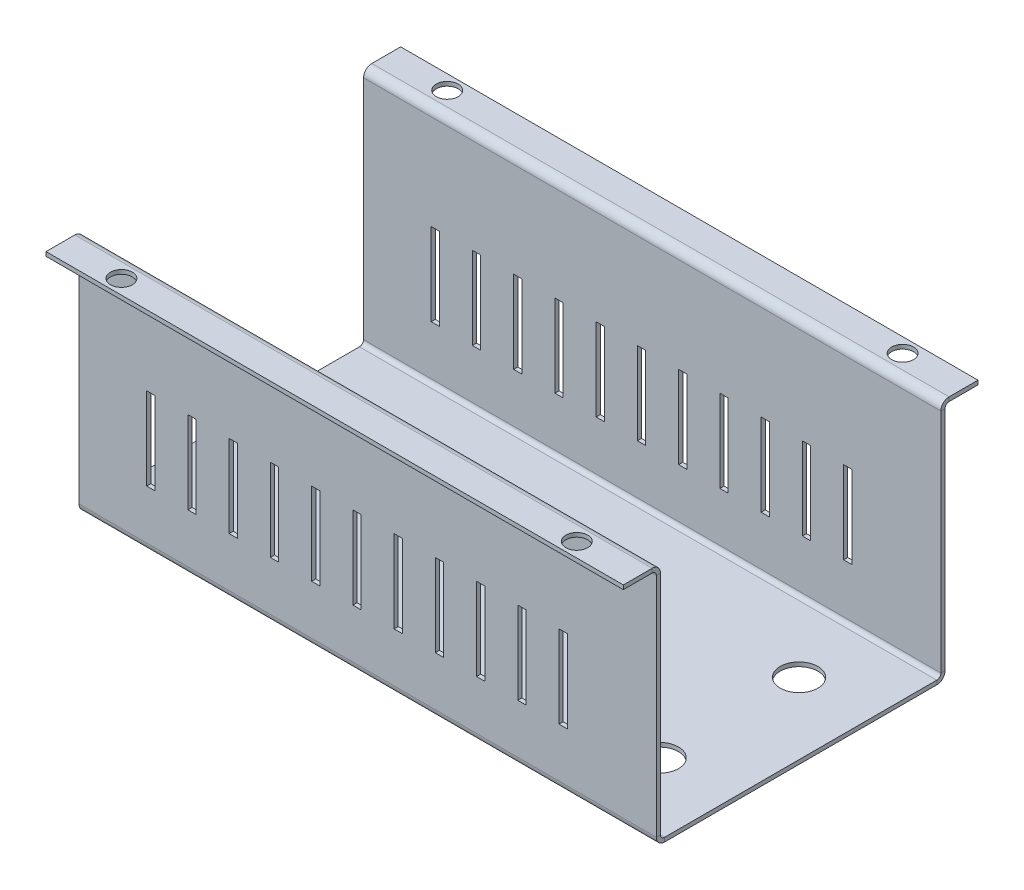
from build123d import *

# Parameters (mm, degrees)
SKETCH1_W                      = 140
SKETCH1_H                      = 70
BASE_FLANGE1_DEPTH             = 1
EDGE_FLANGE1_STRIP_W           = 6
EDGE_FLANGE1_STRIP_H           = 1
EDGE_FLANGE1_STRIP_CUT_DEPTH   = 140
EDGE_FLANGE1_STRIP_2_W         = 6
EDGE_FLANGE1_STRIP_2_H         = 1
EDGE_FLANGE1_STRIP_CUT_2_DEPTH = 140
EDGE_FLANGE1_DEPTH             = 140
EDGE_FLANGE1_BEND_DEPTH        = 140
EDGE_FLANGE2_STRIP_W           = 6
EDGE_FLANGE2_STRIP_H           = 1
EDGE_FLANGE2_STRIP_CUT_DEPTH   = 140
EDGE_FLANGE2_DEPTH             = 140
EDGE_FLANGE3_STRIP_W           = 6
EDGE_FLANGE3_STRIP_H           = 1
EDGE_FLANGE3_STRIP_CUT_DEPTH   = 140
EDGE_FLANGE3_DEPTH             = 140
CUT_EXTRUDE1_DEPTH             = 120.783137378
CUT_EXTRUDE1_DEPTH_BACK        = 120.783137378
SKETCH18_W                     = 2
SKETCH18_H                     = 20
CUT_EXTRUDE2_DEPTH             = 101.56341283
CUT_EXTRUDE2_DEPTH_BACK        = 101.56341283
SKETCH20_R                     = 2.651793261
CUT_EXTRUDE3_DEPTH             = 102.143462468
CUT_EXTRUDE3_DEPTH_BACK        = 102.143462468
SKETCH21_R                     = 4.568960442


# Sheet-metal steps are written as plain solids
with BuildPart() as part:
    # Sketch1 → Base-Flange1 (new body)
    with BuildSketch(Plane(origin=(0, 0, 0), x_dir=(1, 0, 0), z_dir=(0, 1, 0))):
        Rectangle(SKETCH1_W, SKETCH1_H)
    extrude(amount=-BASE_FLANGE1_DEPTH)

    # Edge-Flange1 strip (across the edge) → Edge-Flange1 strip cut (cut)
    with BuildSketch(Plane(origin=(-70, 0, 35), x_dir=(0, 0, -1), z_dir=(1, 0, 0))):
        with Locations((-1, -0.5)):
            Rectangle(EDGE_FLANGE1_STRIP_W, EDGE_FLANGE1_STRIP_H)
    extrude(amount=EDGE_FLANGE1_STRIP_CUT_DEPTH, mode=Mode.SUBTRACT)

    # Edge-Flange1 strip 2 (across the edge) → Edge-Flange1 strip cut 2 (cut)
    with BuildSketch(Plane(origin=(70, 0, -35), x_dir=(0, 0, 1), z_dir=(-1, 0, 0))):
        with Locations((-1, -0.5)):
            Rectangle(EDGE_FLANGE1_STRIP_2_W, EDGE_FLANGE1_STRIP_2_H)
    extrude(amount=EDGE_FLANGE1_STRIP_CUT_2_DEPTH, mode=Mode.SUBTRACT)

    # Edge-Flange1 section (across the edge) → Edge-Flange1 (add)
    with BuildSketch(Plane(origin=(-70, 0, 35), x_dir=(0, 0, -1), z_dir=(1, 0, 0))):
        with BuildLine():
            Line((0, 1), (0, 58))
            Line((0, 58), (1, 58))
            Line((1, 58), (1, 1))
            ThreePointArc((1, 1), (1.292893219, 0.292893219), (2, 0))
            Line((2, 0), (2, -1))
            ThreePointArc((2, -1), (0.585786438, -0.414213562), (0, 1))
        make_face()
    extrude(amount=EDGE_FLANGE1_DEPTH)

    # Edge-Flange1 section 2 (across the edge) → Edge-Flange1 bend (add)
    with BuildSketch(Plane(origin=(70, 0, -35), x_dir=(0, 0, 1), z_dir=(-1, 0, 0))):
        with BuildLine():
            Line((0, 1), (0, 58))
            Line((0, 58), (1, 58))
            Line((1, 58), (1, 1))
            ThreePointArc((1, 1), (1.292893219, 0.292893219), (2, 0))
            Line((2, 0), (2, -1))
            ThreePointArc((2, -1), (0.585786438, -0.414213562), (0, 1))
        make_face()
    extrude(amount=EDGE_FLANGE1_BEND_DEPTH)

    # Edge-Flange2 strip (across the edge) → Edge-Flange2 strip cut (cut)
    with BuildSketch(Plane(origin=(70, 58, 35), x_dir=(0, -1, 0), z_dir=(-1, 0, 0))):
        with Locations((-1, -0.5)):
            Rectangle(EDGE_FLANGE2_STRIP_W, EDGE_FLANGE2_STRIP_H)
    extrude(amount=EDGE_FLANGE2_STRIP_CUT_DEPTH, mode=Mode.SUBTRACT)

    # Edge-Flange2 section (across the edge) → Edge-Flange2 (add)
    with BuildSketch(Plane(origin=(70, 58, 35), x_dir=(0, -1, 0), z_dir=(-1, 0, 0))):
        with BuildLine():
            Line((0, 1), (0, 8))
            Line((0, 8), (1, 8))
            Line((1, 8), (1, 1))
            ThreePointArc((1, 1), (1.292893219, 0.292893219), (2, 0))
            Line((2, 0), (2, -1))
            ThreePointArc((2, -1), (0.585786438, -0.414213562), (0, 1))
        make_face()
    extrude(amount=EDGE_FLANGE2_DEPTH)

    # Edge-Flange3 strip (across the edge) → Edge-Flange3 strip cut (cut)
    with BuildSketch(Plane(origin=(-70, 58, -35), x_dir=(0, -1, 0), z_dir=(1, 0, 0))):
        with Locations((-1, -0.5)):
            Rectangle(EDGE_FLANGE3_STRIP_W, EDGE_FLANGE3_STRIP_H)
    extrude(amount=EDGE_FLANGE3_STRIP_CUT_DEPTH, mode=Mode.SUBTRACT)

    # Edge-Flange3 section (across the edge) → Edge-Flange3 (add)
    with BuildSketch(Plane(origin=(-70, 58, -35), x_dir=(0, -1, 0), z_dir=(1, 0, 0))):
        with BuildLine():
            Line((0, 1), (0, 8))
            Line((0, 8), (1, 8))
            Line((1, 8), (1, 1))
            ThreePointArc((1, 1), (1.292893219, 0.292893219), (2, 0))
            Line((2, 0), (2, -1))
            ThreePointArc((2, -1), (0.585786438, -0.414213562), (0, 1))
        make_face()
    extrude(amount=EDGE_FLANGE3_DEPTH)

    # Sketch18 → Cut-Extrude1 (cut, two sides: drawn at the far end of the back side and taken through both)
    with BuildSketch(Plane.XY.offset(35).offset(-CUT_EXTRUDE1_DEPTH_BACK)):
        with Locations((-42.587057136, 22.971771136)):
            Rectangle(SKETCH18_W, SKETCH18_H)
        with Locations((-52.587057136, 22.971771136)):
            Rectangle(SKETCH18_W, SKETCH18_H)
        with Locations((-32.587057136, 22.971771136)):
            Rectangle(SKETCH18_W, SKETCH18_H)
        with Locations((-22.587057136, 22.971771136)):
            Rectangle(SKETCH18_W, SKETCH18_H)
        with Locations((-12.587057136, 22.971771136)):
            Rectangle(SKETCH18_W, SKETCH18_H)
        with Locations((-2.587057136, 22.971771136)):
            Rectangle(SKETCH18_W, SKETCH18_H)
        with Locations((7.412942864, 22.971771136)):
            Rectangle(SKETCH18_W, SKETCH18_H)
        with Locations((17.412942864, 22.971771136)):
            Rectangle(SKETCH18_W, SKETCH18_H)
        with Locations((27.412942864, 22.971771136)):
            Rectangle(SKETCH18_W, SKETCH18_H)
        with Locations((37.412942864, 22.971771136)):
            Rectangle(SKETCH18_W, SKETCH18_H)
        with Locations((47.412942864, 22.971771136)):
            Rectangle(SKETCH18_W, SKETCH18_H)
    extrude(amount=CUT_EXTRUDE1_DEPTH + CUT_EXTRUDE1_DEPTH_BACK, mode=Mode.SUBTRACT)

    # Sketch20 → Cut-Extrude2 (cut, two sides: drawn at the far end of the back side and taken through both)
    with BuildSketch(Plane.XZ.offset(-57).offset(-CUT_EXTRUDE2_DEPTH_BACK)):
        with Locations(Location((-55.216327322, 39.5, 0), (0, 0, 270))):
            Circle(SKETCH20_R)
        with Locations(Location((-55.216327322, -39.5, 0), (0, 0, 270))):
            Circle(SKETCH20_R)
        with Locations(Location((55.216327322, -39.5, 0), (0, 0, 270))):
            Circle(SKETCH20_R)
        with Locations(Location((55.216327322, 39.5, 0), (0, 0, 270))):
            Circle(SKETCH20_R)
    extrude(amount=CUT_EXTRUDE2_DEPTH + CUT_EXTRUDE2_DEPTH_BACK, mode=Mode.SUBTRACT)

    # Sketch21 → Cut-Extrude3 (cut, two sides: drawn at the far end of the back side and taken through both)
    with BuildSketch(Plane.XZ.offset(1).offset(-CUT_EXTRUDE3_DEPTH_BACK)):
        with Locations(Location((52.700809146, 16.902528803, 0), (0, 0, 270))):
            Circle(SKETCH21_R)
        with Locations(Location((52.700809146, -16.902528803, 0), (0, 0, 270))):
            Circle(SKETCH21_R)
    extrude(amount=CUT_EXTRUDE3_DEPTH + CUT_EXTRUDE3_DEPTH_BACK, mode=Mode.SUBTRACT)


solid = part.part
